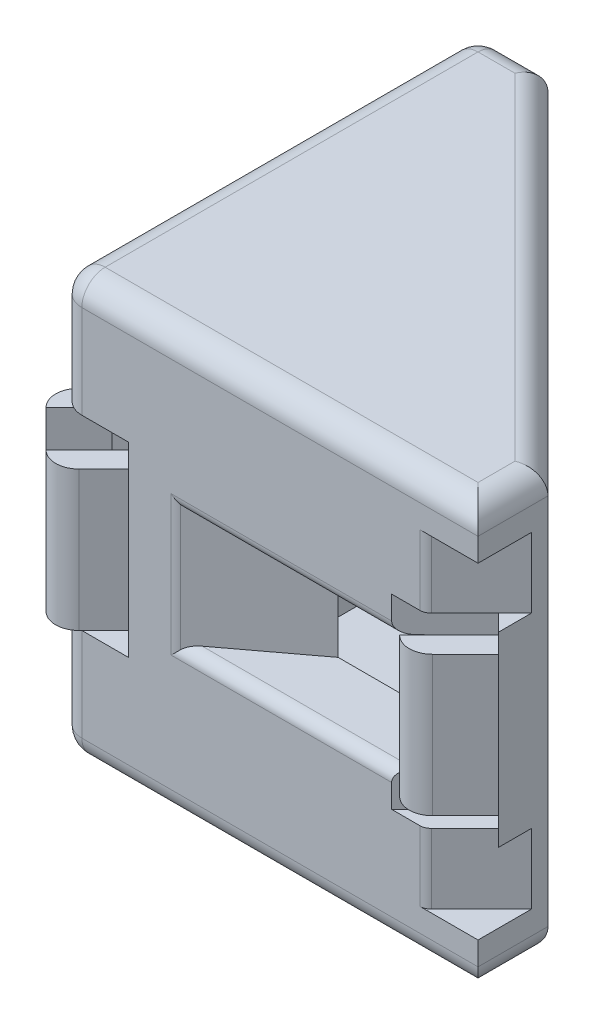
from build123d import *

# Parameters (mm, degrees)
BOSS_EXTRUDE1_DEPTH = 18
SKETCH2_W           = 15
SKETCH2_H           = 14
CUT_EXTRUDE1_DEPTH  = 15
CUT_EXTRUDE2_START  = -3.742641
SKETCH7_W           = 2
SKETCH7_H           = 3
CUT_EXTRUDE2_DEPTH  = 3.242641
CUT_EXTRUDE4_REACH  = 30.583
SKETCH9_W           = 1
SKETCH9_H           = 6
BOSS_EXTRUDE2_DEPTH = 3
CUT_EXTRUDE5_REACH  = 30.583
SKETCH11_W          = 1
SKETCH11_H          = 6
BOSS_EXTRUDE3_DEPTH = 3
CUT_EXTRUDE6_DEPTH  = 4
SKETCH13_W          = 1
SKETCH13_H          = 6
BOSS_EXTRUDE4_DEPTH = 2.5
SKETCH14_W          = 1
SKETCH14_H          = 8
BOSS_EXTRUDE5_DEPTH = 0.5
FILLET3_R           = 1
FILLET4_R           = 0.5


with BuildPart() as part:
    # Sketch1 → Boss-Extrude1 (new body)
    with BuildSketch(Plane(origin=(0, 0, 0), x_dir=(1, 0, 0), z_dir=(0, 1, 0))):
        Polygon((0, 0), (0, 18), (3, 18), (18, 3), (18, 0), align=None)
    extrude(amount=BOSS_EXTRUDE1_DEPTH)

    # Sketch2 → Cut-Extrude1 (cut)
    with BuildSketch(Plane(origin=(0, 0, -18), x_dir=(-1, 0, 0), z_dir=(0, 0, -1))):
        with Locations((-10.5, 9)):
            Rectangle(SKETCH2_W, SKETCH2_H)
    extrude(amount=-CUT_EXTRUDE1_DEPTH, mode=Mode.SUBTRACT)

    # Sketch3 → Cut-Loft1 section 0
    with BuildSketch(Plane(origin=(0, 0, -3), x_dir=(-1, 0, 0), z_dir=(0, 0, -1))):
        with BuildLine():
            Line((-15, 11.5), (-9, 11.5))
            Line((-9, 11.5), (-9, 6.5))
            Line((-9, 6.5), (-15, 6.5))
            Line((-15, 6.5), (-15, 11.5))
        make_face()
    # Sketch6 → Cut-Loft1 section 1
    with BuildSketch(Plane.XY):
        with BuildLine():
            Line((15, 11.5), (5, 11.5))
            Line((5, 11.5), (5, 6.5))
            Line((5, 6.5), (15, 6.5))
            Line((15, 6.5), (15, 11.5))
        make_face()
    loft(mode=Mode.SUBTRACT)

    # Sketch4 → Cut-Loft2 section 0
    with BuildSketch(Plane(origin=(3, 0, 0), x_dir=(0, 0, -1), z_dir=(1, 0, 0))):
        with BuildLine():
            Line((9, 11.5), (15, 11.5))
            Line((15, 11.5), (15, 6.5))
            Line((15, 6.5), (9, 6.5))
            Line((9, 6.5), (9, 11.5))
        make_face()
    # Sketch5 → Cut-Loft2 section 1
    with BuildSketch(Plane.ZY):
        with BuildLine():
            Line((-15, 11.5), (-5, 11.5))
            Line((-5, 11.5), (-5, 6.5))
            Line((-5, 6.5), (-15, 6.5))
            Line((-15, 6.5), (-15, 11.5))
        make_face()
    loft(mode=Mode.SUBTRACT)

    # Sketch7 → Cut-Extrude2 (cut)
    with BuildSketch(Plane(origin=(10.5, 0, -10.5), x_dir=(-0.7071067811865475, 0, -0.7071067811865477), z_dir=(0.7071067811865477, 0, -0.7071067811865475)).offset(CUT_EXTRUDE2_START)):
        with Locations((12.106601718, 14.5)):
            Rectangle(SKETCH7_W, SKETCH7_H)
        with Locations((12.106601718, 3.5)):
            Rectangle(SKETCH7_W, SKETCH7_H)
        with Locations((-12.106601718, 14.5)):
            Rectangle(SKETCH7_W, SKETCH7_H)
        with Locations((-12.106601718, 3.5)):
            Rectangle(SKETCH7_W, SKETCH7_H)
    extrude(amount=CUT_EXTRUDE2_DEPTH, mode=Mode.SUBTRACT)

    # Cut-Extrude4: up to this face of the body (flat: up to its plane)
    cut_extrude4_end = Plane(part.part.faces().sort_by_distance((0.76429774, 13, -17.23570226))[0])
    # Sketch8 → Cut-Extrude4 (cut, up to the picked face)
    with BuildSketch(Plane.XZ.offset(-5), mode=Mode.PRIVATE) as cut_extrude4_sk1:
        Polygon((0.707163247, -18), (2.207135014, -16.500028233), (-0.113993924, -14.178899295), (-1.613965691, -15.678871062), align=None)
    cut_extrude4_tool1 = split(extrude(cut_extrude4_sk1.sketch, amount=-CUT_EXTRUDE4_REACH, mode=Mode.PRIVATE), bisect_by=cut_extrude4_end, keep=Keep.BOTH, mode=Mode.PRIVATE)
    add(cut_extrude4_tool1.solids().sort_by(Axis((0.296585, 5, -16.08945), (0, 1, 0)))[0], mode=Mode.SUBTRACT)


with BuildPart() as cut_extrude4_kept_piece:
    # of the separate pieces the step leaves, the one the design keeps (cut_extrude4_pieces_kept)
    add(part.part.solids().sort_by_distance((0, 0, 0))[0])

    # Sketch9 → Boss-Extrude2 (add)
    with BuildSketch(Plane(origin=(9.353581623, 0, -9.353581623), x_dir=(0.7071067811865475, 0, 0.7071067811865477), z_dir=(-0.7071067811865477, 0, 0.7071067811865475))):
        with Locations((-11.477882134, 9)):
            Rectangle(SKETCH9_W, SKETCH9_H)
    extrude(amount=BOSS_EXTRUDE2_DEPTH)

    # Cut-Extrude5: up to this face of the body (flat: up to its plane)
    cut_extrude5_end = Plane(cut_extrude4_kept_piece.part.faces().sort_by_distance((17.23570226, 5, -0.76429774))[0])
    # Sketch10 → Cut-Extrude5 (cut, up to the picked face)
    with BuildSketch(Plane(origin=(0, 13, 0), x_dir=(1, 0, 0), z_dir=(0, 1, 0)), mode=Mode.PRIVATE) as cut_extrude5_sk1:
        Polygon((18.647815387, 0.23086427), (16.585786438, 2.292893219), (13.714418547, -0.578474672), (15.776447496, -2.640503621), align=None)
    cut_extrude5_tool1 = split(extrude(cut_extrude5_sk1.sketch, amount=-CUT_EXTRUDE5_REACH, mode=Mode.PRIVATE), bisect_by=cut_extrude5_end, keep=Keep.BOTH, mode=Mode.PRIVATE)
    add(cut_extrude5_tool1.solids().sort_by(Axis((16.181117, 13, 0.173805), (0, -1, 0)))[0], mode=Mode.SUBTRACT)

    # Sketch11 → Boss-Extrude3 (add)
    with BuildSketch(Plane(origin=(9.439339828, 0, -9.439339828), x_dir=(0.7071067811865474, 0, 0.7071067811865478), z_dir=(-0.7071067811865478, 0, 0.7071067811865474))):
        with Locations((11.356601718, 9)):
            Rectangle(SKETCH11_W, SKETCH11_H)
    extrude(amount=BOSS_EXTRUDE3_DEPTH)

    # Sketch12 → Cut-Extrude6 (cut, symmetric)
    with BuildSketch(Plane(origin=(0, 9, 0), x_dir=(1, 0, 0), z_dir=(0, 1, 0))):
        Polygon((0, 3), (0, 0), (3, 0), align=None)
    extrude(amount=CUT_EXTRUDE6_DEPTH, both=True, mode=Mode.SUBTRACT)

    # Sketch13 → Boss-Extrude4 (add)
    with BuildSketch(Plane(origin=(1.5, 0, -1.5), x_dir=(0.7071067811865475, 0, 0.7071067811865477), z_dir=(-0.7071067811865477, 0, 0.7071067811865475))):
        with Locations((1.621320344, 9)):
            Rectangle(SKETCH13_W, SKETCH13_H)
        with Locations((-1.621320344, 9)):
            Rectangle(SKETCH13_W, SKETCH13_H)
    extrude(amount=BOSS_EXTRUDE4_DEPTH)

    # Sketch14 → Boss-Extrude5 (add, symmetric)
    with BuildSketch(Plane(origin=(1.5, 0, -1.5), x_dir=(0.7071067811865475, 0, 0.7071067811865477), z_dir=(-0.7071067811865477, 0, 0.7071067811865475))):
        with Locations((0, 9)):
            Rectangle(SKETCH14_W, SKETCH14_H)
    extrude(amount=BOSS_EXTRUDE5_DEPTH, both=True)

    # Fillet3
    fillet3_edges = [cut_extrude4_kept_piece.edges().sort_by_distance(p)[0] for p in [
        (-1.237380402, 9, -15.701902961),
        (-1.767766953, 9, -1.232233047),
        (1.232233047, 9, 1.767766953),
        (15.701902961, 9, 1.065863992),
        (0, 1, -18),
        (0, 17, -18),
        (1.5, 18, -18),
        (1.5, 0, -18),
        (9, 0, 0),
        (18, 0, -1.5),
        (10.5, 0, -10.5),
        (9, 18, 0),
        (18, 18, -1.5),
        (10.5, 18, -10.5),
        (0, 18, -9),
        (0, 0, -9),
        (0, 15.5, 0),
        (0, 2.5, 0),
    ]]
    fillet(fillet3_edges, radius=FILLET3_R - 0.0001)  # a hair under: the kernel refuses the full size

    # Fillet4
    fillet4_edges = [cut_extrude4_kept_piece.edges().sort_by_distance(p)[0] for p in [
        (15.70710656, 14.5, 2.21e-07),
        (15.70710656, 3.5, 2.21e-07),
        (5, 9, 0),
        (9.646446609, 6.5, 0),
        (0, 9, -5),
        (9.646446609, 11.5, 0),
        (0, 6.5, -9.646446609),
        (0, 11.5, -9.646446609),
        (-2.21e-07, 14.5, -15.70710656),
        (-2.21e-07, 3.5, -15.70710656),
    ]]
    fillet(fillet4_edges, radius=FILLET4_R)


solid = cut_extrude4_kept_piece.part
